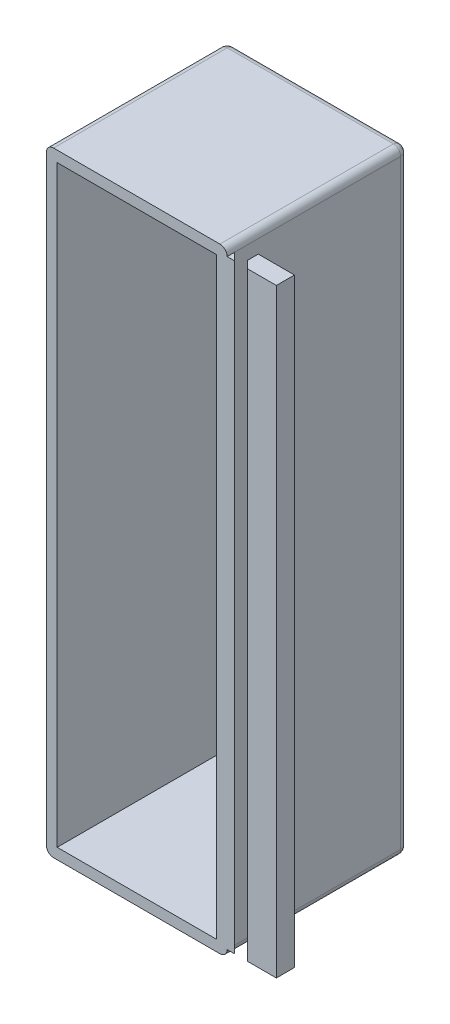
from build123d import *

# Parameters (mm, degrees)
SKETCH2_W           = 50
SKETCH2_H           = 170
BOSS_EXTRUDE1_DEPTH = 50
SKETCH3_W           = 44
SKETCH3_H           = 164
CUT_EXTRUDE1_DEPTH  = 47
FILLET2_R           = 2
SKETCH4_W           = 2
SKETCH4_H           = 166
BOSS_EXTRUDE2_DEPTH = 2
CUT_EXTRUDE2_DEPTH  = 170
SKETCH6_W           = 10
SKETCH6_H           = 165.895682702
BOSS_EXTRUDE3_DEPTH = 5
CUT_EXTRUDE4_DEPTH  = 180


with BuildPart() as part:
    # Sketch2 → Boss-Extrude1 (new body)
    with BuildSketch(Plane.XY):
        Rectangle(SKETCH2_W, SKETCH2_H)
    extrude(amount=BOSS_EXTRUDE1_DEPTH)

    # Sketch3 → Cut-Extrude1 (cut)
    with BuildSketch(Plane.XY.offset(50)):
        Rectangle(SKETCH3_W, SKETCH3_H)
    extrude(amount=-CUT_EXTRUDE1_DEPTH, mode=Mode.SUBTRACT)

    # Fillet2
    fillet2_edges = [part.edges().sort_by_distance(p)[0] for p in [
        (25, -85, 25),
        (25, 0, 0),
        (0, -85, 0),
        (-25, -85, 25),
        (-25, 0, 0),
        (25, 85, 25),
        (0, 85, 0),
        (-25, 85, 25),
    ]]
    fillet(fillet2_edges, radius=FILLET2_R)

    # Sketch4 → Boss-Extrude2 (add)
    with BuildSketch(Plane(origin=(25, 0, 0), x_dir=(0, 0, -1), z_dir=(1, 0, 0))):
        with Locations((-49, 0)):
            Rectangle(SKETCH4_W, SKETCH4_H)
    extrude(amount=BOSS_EXTRUDE2_DEPTH)

    # Sketch5 → Cut-Extrude2 (cut)
    with BuildSketch(Plane.XZ.offset(83)):
        Polygon((25, 48), (27, 50), (27, 48), align=None)
    extrude(amount=-CUT_EXTRUDE2_DEPTH, mode=Mode.SUBTRACT)


with BuildPart() as body_2:
    # Sketch6 → Boss-Extrude3 (new body)
    with BuildSketch(Plane.XY.offset(50)):
        with Locations((33.616958885, -0.052158649)):
            Rectangle(SKETCH6_W, SKETCH6_H)
    extrude(amount=-BOSS_EXTRUDE3_DEPTH)

    # Sketch8 → Cut-Extrude4 (cut)
    with BuildSketch(Plane(origin=(0, -83, 0), x_dir=(-1, 0, 0), z_dir=(0, -1, 0))):
        Polygon((-28.616958885, -48), (-30.616958885, -50), (-28.616958885, -50), align=None)
    extrude(amount=-CUT_EXTRUDE4_DEPTH, mode=Mode.SUBTRACT)


solid = Compound([part.part, body_2.part])
